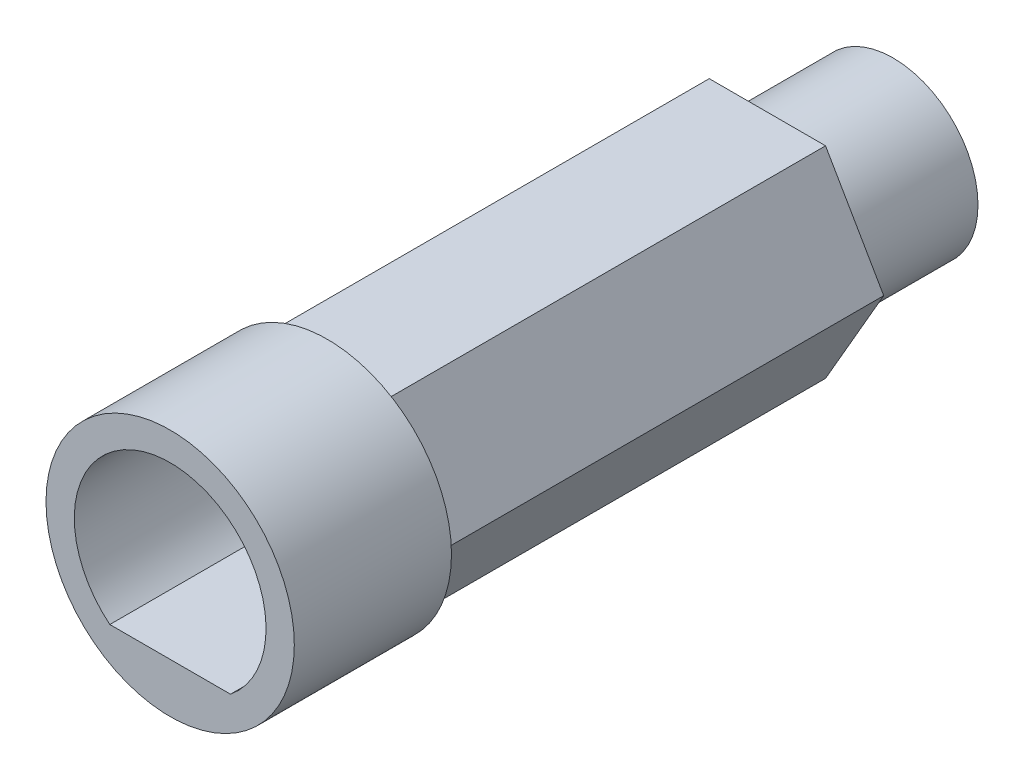
from build123d import *

# Parameters (mm, degrees)
BOSS_EXTRUDE1_DEPTH = 14
SKETCH2_R           = 3.95
BOSS_EXTRUDE2_DEPTH = 5
SKETCH3_R           = 2.7
BOSS_EXTRUDE3_DEPTH = 4
CUT_EXTRUDE1_DEPTH  = 16


with BuildPart() as part:
    # Sketch1 → Boss-Extrude1 (new body)
    with BuildSketch(Plane.XY):
        Polygon((3.7, 0), (1.85, 3.204293994), (-1.85, 3.204293994), (-3.7, 0), (-1.85, -3.204293994), (1.85, -3.204293994), align=None)
    extrude(amount=BOSS_EXTRUDE1_DEPTH)

    # Sketch2 → Boss-Extrude2 (add)
    with BuildSketch(Plane.XY.offset(14)):
        Circle(SKETCH2_R)
    extrude(amount=BOSS_EXTRUDE2_DEPTH)

    # Sketch3 → Boss-Extrude3 (add)
    with BuildSketch(Plane(origin=(0, 0, 0), x_dir=(-1, 0, 0), z_dir=(0, 0, -1))):
        Circle(SKETCH3_R)
    extrude(amount=BOSS_EXTRUDE3_DEPTH)

    # Sketch4 → Cut-Extrude1 (cut)
    with BuildSketch(Plane.XY.offset(19)):
        with BuildLine():
            ThreePointArc((3.05, 0), (-1.312847183, 2.752986065), (-1.919791655, -2.37))
            Line((-1.919791655, -2.37), (1.919791655, -2.37))
            ThreePointArc((1.919791655, -2.37), (2.752986065, -1.312847183), (3.05, 0))
        make_face()
    extrude(amount=-CUT_EXTRUDE1_DEPTH, mode=Mode.SUBTRACT)


solid = part.part
